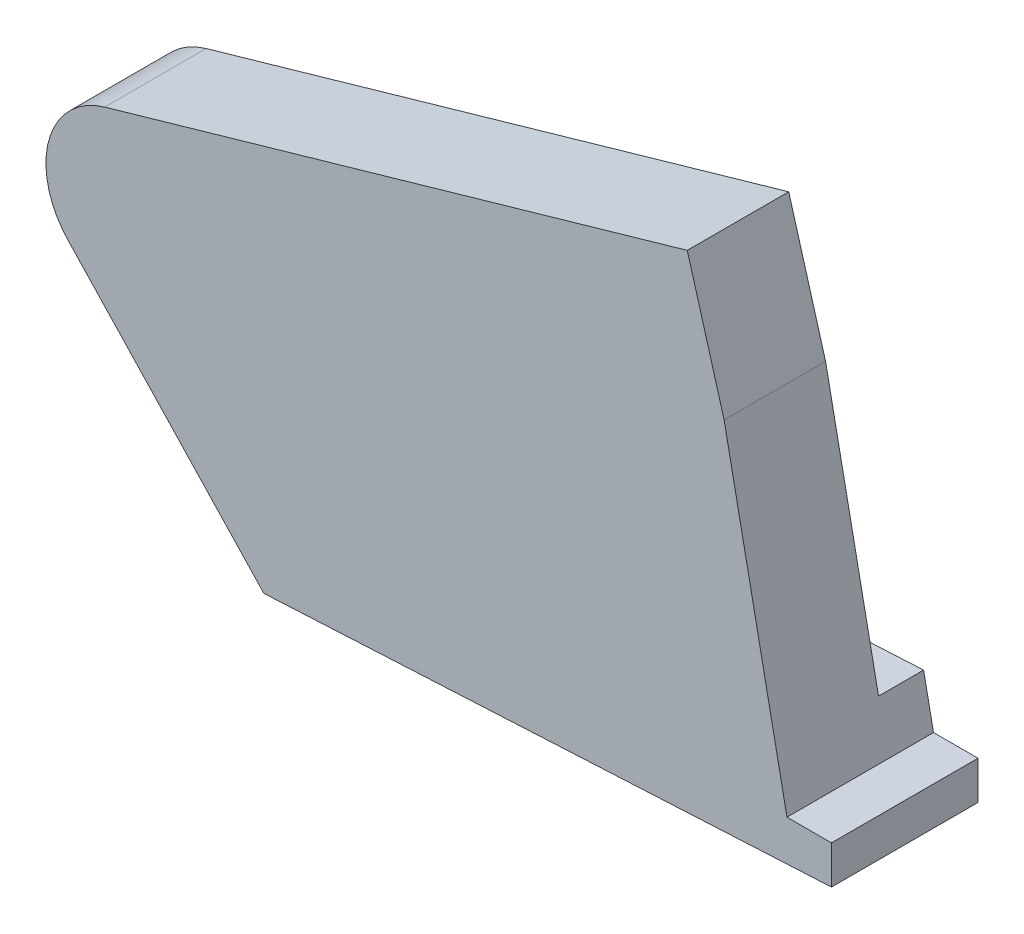
from build123d import *

# Parameters (mm, degrees)
BOSS_EXTRUDE1_DEPTH = 14.2875
BOSS_EXTRUDE2_DEPTH = 6.35
FILLET4_R           = 11.43


with BuildPart() as part:
    # Sketch1 → Boss-Extrude1 (new body)
    with BuildSketch(Plane.XY):
        Polygon((73.860787854, -499.437803803), (173.917121174, -470.718059994), (179.107755707, -488.80164258), (187.959805713, -532.826823397), (194.223325192, -532.826823397), (194.223325192, -538.222734742), (114.286306688, -542.370121825), align=None)
    extrude(amount=BOSS_EXTRUDE1_DEPTH)

    # Sketch2 → Boss-Extrude2 (add)
    with BuildSketch(Plane(origin=(0, 0, 0), x_dir=(-1, 0, 0), z_dir=(0, 0, -1))):
        Polygon((-194.223325192, -532.826823397), (-187.959805713, -532.826823397), (-186.5676181, -525.902855352), (-120.584571546, -529.326265933), (-114.286306688, -542.370121825), (-194.223325192, -538.222734742), align=None)
    extrude(amount=BOSS_EXTRUDE2_DEPTH)

    # Fillet4
    fillet4_edges = [part.edges().sort_by_distance(p)[0] for p in [
        (73.860787854, -499.437803803, 7.14375),
    ]]
    fillet(fillet4_edges, radius=FILLET4_R)


solid = part.part
